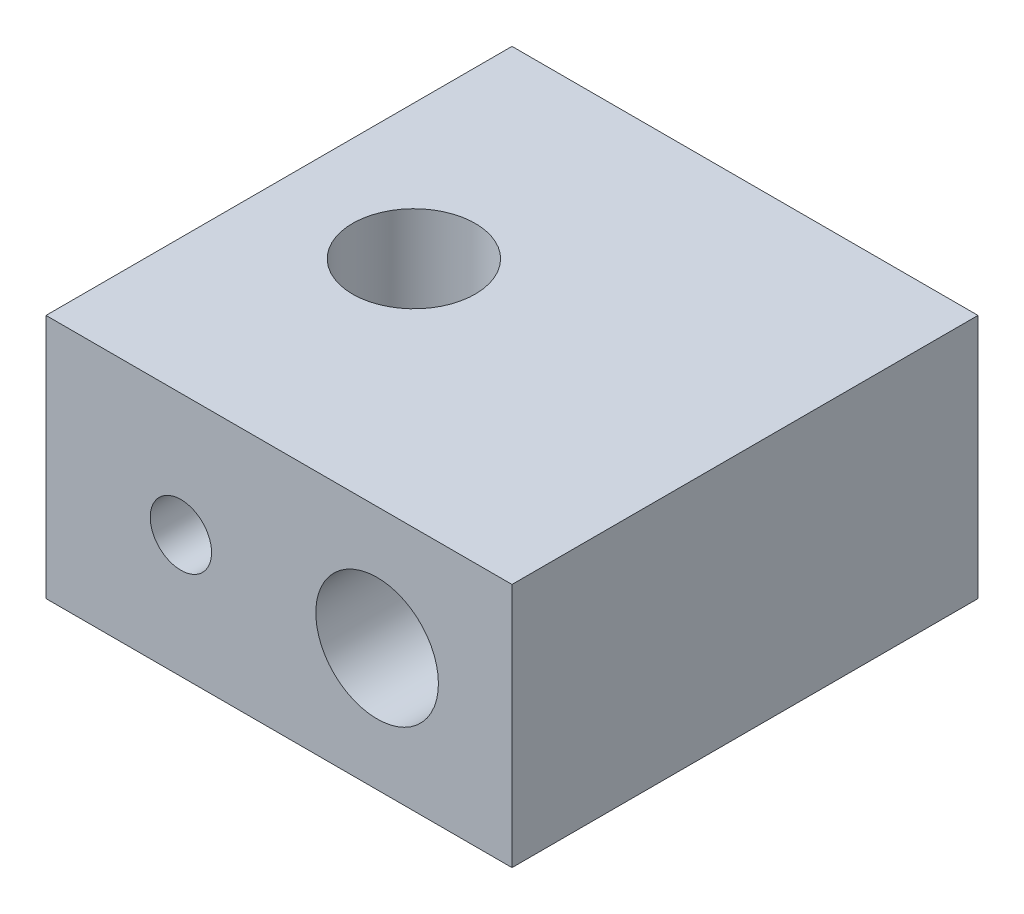
from build123d import *

# Parameters (mm, degrees)
SKETCH1_W           = 19
SKETCH1_H           = 19
BOSS_EXTRUDE1_DEPTH = 10
SKETCH2_R           = 2.5
CUT_EXTRUDE1_DEPTH  = 17.748134224
SKETCH3_R           = 1.25
CUT_EXTRUDE2_DEPTH  = 5
SKETCH4_R           = 2.5
CUT_EXTRUDE3_DEPTH  = 24.478713764
SKETCH5_R           = 3.25
CUT_EXTRUDE4_DEPTH  = 1.5
SKETCH6_R           = 1.25
CUT_EXTRUDE5_DEPTH  = 5


with BuildPart() as part:
    # Sketch1 → Boss-Extrude1 (new body)
    with BuildSketch(Plane(origin=(0, 0, 0), x_dir=(1, 0, 0), z_dir=(0, 1, 0))):
        Rectangle(SKETCH1_W, SKETCH1_H)
    extrude(amount=BOSS_EXTRUDE1_DEPTH)

    # Sketch2 → Cut-Extrude1 (cut, through all)
    with BuildSketch(Plane(origin=(0, 10, 0), x_dir=(1, 0, 0), z_dir=(0, 1, 0))):
        with Locations((-4, 0)):
            Circle(SKETCH2_R)
    extrude(amount=-CUT_EXTRUDE1_DEPTH, mode=Mode.SUBTRACT)

    # Sketch3 → Cut-Extrude2 (cut)
    with BuildSketch(Plane.XY.offset(9.5)):
        with Locations((-4, 5)):
            Circle(SKETCH3_R)
    extrude(amount=-CUT_EXTRUDE2_DEPTH, mode=Mode.SUBTRACT)

    # Sketch4 → Cut-Extrude3 (cut, through all)
    with BuildSketch(Plane.XY.offset(9.5)):
        with Locations((4, 5)):
            Circle(SKETCH4_R)
    extrude(amount=-CUT_EXTRUDE3_DEPTH, mode=Mode.SUBTRACT)

    # Sketch5 → Cut-Extrude4 (cut)
    with BuildSketch(Plane.XZ):
        with Locations((-4, 0)):
            Circle(SKETCH5_R)
    extrude(amount=-CUT_EXTRUDE4_DEPTH, mode=Mode.SUBTRACT)

    # Sketch6 → Cut-Extrude5 (cut)
    with BuildSketch(Plane.XZ):
        with Locations((4, 0)):
            Circle(SKETCH6_R)
    extrude(amount=-CUT_EXTRUDE5_DEPTH, mode=Mode.SUBTRACT)


solid = part.part
